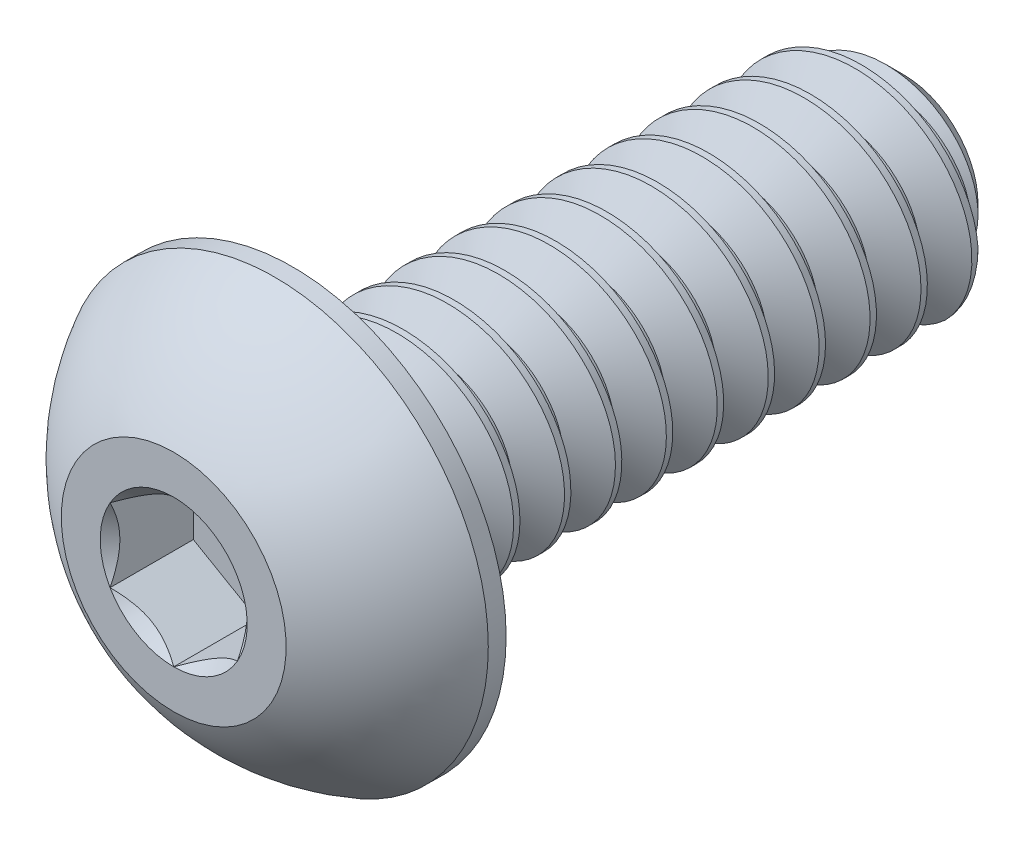
from build123d import *

# Parameters (mm, degrees)
SKETCH1_W          = 9.525
SKETCH1_H          = 1.7526
CHAMFER1_SIZE      = 0.5953125
CUT_SWEEP1_PITCH   = 0.79375
CUT_EXTRUDE2_DEPTH = 1.29794


with BuildPart() as part:
    # Sketch1 → Revolve1 (revolve)
    with BuildSketch(Plane(origin=(0, 0, 0), x_dir=(0, 0, -1), z_dir=(1, 0, 0))):
        with Locations((6.6167, 0.8763)):
            Rectangle(SKETCH1_W, SKETCH1_H)
    revolve(axis=Axis((0, 0, -11.3792), (0, 0, 1)))

    # Chamfer1
    chamfer1_edges = [part.edges().sort_by_distance(p)[0] for p in [
        (0, -1.7526, -11.3792),
    ]]
    chamfer(chamfer1_edges, length=CHAMFER1_SIZE)

    # Cut-Sweep1: the profile of Sketch2 profile screwed along a right-hand helix of 13 turns, 8 arcs to a turn; built about Z, then put on its axis
    cut_sweep1_z = Axis((0, 0, 0), (0, 0, 1))
    cut_sweep1_corners = [(1.7529, 0, 0.000173205), (1.7529, 0, -0.694704455), (1.237044252, 0, -0.396875), (1.237044252, 0, -0.29765625)]
    with BuildLine(mode=Mode.PRIVATE) as cut_sweep1_profile:
        Line(cut_sweep1_corners[0], cut_sweep1_corners[1])
        Line(cut_sweep1_corners[1], cut_sweep1_corners[2])
        Line(cut_sweep1_corners[2], cut_sweep1_corners[3])
        Line(cut_sweep1_corners[3], cut_sweep1_corners[0])
    cut_sweep1_cap = Face(cut_sweep1_profile.wire())
    cut_sweep1_turn_angles = [0, 22.5, 45, 67.5, 90, 112.5, 135, 157.5, 180, 202.5, 225, 247.5, 270, 292.5, 315, 337.5, 360]
    cut_sweep1_turn_weights = [1, 0.9238795325112867, 1, 0.9238795325112867, 1, 0.9238795325112867, 1, 0.9238795325112867, 1, 0.9238795325112867, 1, 0.9238795325112867, 1, 0.9238795325112867, 1, 0.9238795325112867, 1]
    cut_sweep1_turn_rails = [Edge.make_bspline([Vector(p[0], p[1], 0).rotate(cut_sweep1_z, cut_sweep1_turn_angles[k]) / cut_sweep1_turn_weights[k] + Vector(0, 0, p[2] + CUT_SWEEP1_PITCH * cut_sweep1_turn_angles[k] / 360) for k in range(17)], [0, 0, 0, 1, 1, 2, 2, 3, 3, 4, 4, 5, 5, 6, 6, 7, 7, 8, 8, 8], 2, cut_sweep1_turn_weights) for p in cut_sweep1_corners]
    cut_sweep1_turn_sides = [Face.make_surface_from_curves(cut_sweep1_turn_rails[p[0]], cut_sweep1_turn_rails[p[1]]) for p in [(0, 1), (1, 2), (2, 3), (3, 0)]]
    cut_sweep1 = Plane(origin=(0, 0, -11.3792), x_dir=(0, 1, 0), z_dir=(0, 0, 1)) * Solid(Shell([*[p.moved(Location((0, 0, CUT_SWEEP1_PITCH * i))) for i in range(13) for p in cut_sweep1_turn_sides], cut_sweep1_cap, cut_sweep1_cap.rotate(cut_sweep1_z, 4680).moved(Location((0, 0, CUT_SWEEP1_PITCH * 4680 / 360)))]))
    add(cut_sweep1, mode=Mode.SUBTRACT)

    # Sketch7 → Revolve2 (revolve)
    with BuildSketch(Plane(origin=(0, 0, 0), x_dir=(0, 0, -1), z_dir=(1, 0, 0)), mode=Mode.PRIVATE) as revolve2_sk:
        with BuildLine():
            Line((1.57607, 3.3274), (1.8542, 3.3274))
            Line((1.8542, 3.3274), (1.8542, 0))
            Line((1.8542, 0), (0, 0))
            Line((0, 0), (0, 1.7526))
            ThreePointArc((0, 1.7526), (0.668695369, 2.659435873), (1.57607, 3.3274))
        make_face()
    revolve(revolve2_sk.sketch.rotate(Axis((0, 0, 0), (0, 0, -1)), 189.052465709), axis=Axis((0, 0, 0), (0, 0, -1)))

    # Sketch5 → Cut-Extrude2 (cut)
    with BuildSketch(Plane.XY):
        Polygon((0.9921875, -0.57283972), (0.9921875, 0.57283972), (0, 1.14567944), (-0.9921875, 0.57283972), (-0.9921875, -0.57283972), (0, -1.14567944), align=None)
    extrude(amount=-CUT_EXTRUDE2_DEPTH, mode=Mode.SUBTRACT)

    # Cut-Extrude3 cone 1 section (through the dimple's axis) → Cut-Extrude3 (revolve, cut)
    with BuildSketch(Plane(origin=(0, 0, 0), x_dir=(0, -1, 0), z_dir=(1, 0, 0))):
        Polygon((0, 0), (1.14567944, 0), (0, 1.14567944), align=None)
    revolve(axis=Axis((0, 0, 0), (0, 0, -1)), mode=Mode.SUBTRACT)


solid = part.part
